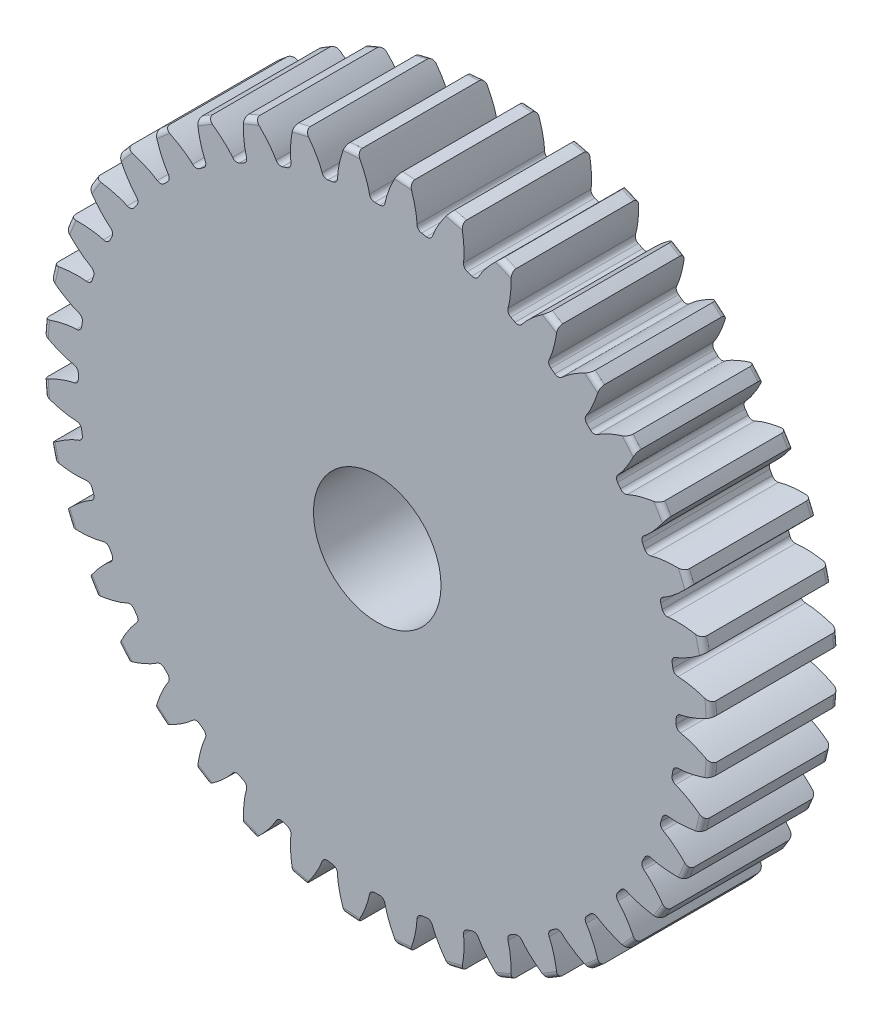
from build123d import *

# Parameters (mm, degrees)
BOSS_EXTRUDE1_DEPTH      = 7.1374
BOSS_EXTRUDE1_DEPTH_BACK = 7.1374
SKETCH3_R                = 16.66875
FILLET2_R                = 0.2663071221911928
CUT_EXTRUDE1_DEPTH       = 25.630000743934822
FILLET1_R                = 0.2663071221911928
CIRPATTERN1_COUNT        = 40
FILLET1_OF_CIRPATTERN1_R = 0.2663071221911928
CUT_EXTRUDE2_DEPTH       = 25.588822980641915
CUT_EXTRUDE2_DEPTH_BACK  = 25.588822980641915
SKETCH6_W                = 24.66629875686308
SKETCH6_H                = 10.369952092948171


with BuildPart() as part:
    # Sketch3 → Boss-Extrude1 (new, two sides: drawn at the far end of the back side and taken through both)
    with BuildSketch(Plane.XY.offset(-BOSS_EXTRUDE1_DEPTH_BACK)):
        Circle(SKETCH3_R)
    extrude(amount=BOSS_EXTRUDE1_DEPTH + BOSS_EXTRUDE1_DEPTH_BACK)

    # Sketch5 → Cut-Revolve1 (revolve, cut)
    with BuildSketch(Plane(origin=(0, 0, 0), x_dir=(0, 0, -1), z_dir=(1, 0, 0)), mode=Mode.PRIVATE) as cut_revolve1_sk:
        Polygon((-7.1373999999999995, 16.66875), (0.7873999999999978, 16.66875), (0.7873999999999987, 9.144), (-7.137399999999999, 9.144), align=None)
        Polygon((7.1373999999999995, 3.1750000000000007), (-7.1373999999999995, 3.174999999999999), (-7.1373999999999995, 0), (7.1373999999999995, 0), align=None)
    revolve(cut_revolve1_sk.sketch.rotate(Axis((0, 0, 7.1373999999999995), (0, 0, -1)), 90), axis=Axis((0, 0, 7.1373999999999995), (0, 0, -1)), mode=Mode.SUBTRACT)

    # Fillet2
    fillet2_edges = [part.edges().sort_by_distance(p)[0] for p in [
        (-3.174999999999999, -7.4e-16, 7.1373999999999995),
        (-3.1750000000000007, 6.7e-16, -7.1373999999999995),
        (-9.144, -2.14e-15, 7.137399999999999),
        (-9.144, -2.14e-15, -0.787399999999999),
        (-16.66875, -3.89e-15, -0.7873999999999981),
        (-16.66875, 2.04e-15, -7.1374),
    ]]
    fillet(fillet2_edges, radius=FILLET2_R)

    # Sketch4 → Cut-Extrude1 (cut, symmetric)
    with BuildSketch(Plane.XY):
        with BuildLine():
            Line((14.878394913615425, 0.3625916500126888), (14.913192436760546, 0.36343967773387753))
            add(Edge.make_bspline(
                [(14.913192436760546, 0.36343967773387753), (14.915932121481475, 0.36353536483762616), (14.923613753636184, 0.36389326556183066), (14.93812595328096, 0.364923436516246), (14.961789134486567, 0.3671065924709044), (14.991912200216108, 0.37062653396886414), (15.030810506890388, 0.3760239054275654), (15.076581712175361, 0.38347260287085266), (15.126823169889589, 0.3928010522901414), (15.181412660716978, 0.40418318886428944), (15.235805401505349, 0.41662899343107934), (15.289996240249774, 0.43005935981920074), (15.34391335816814, 0.4443535809238675), (15.409141174945624, 0.46275039060258905), (15.487236161426905, 0.48631369719140805), (15.578328649331821, 0.5160465696804971), (15.681407363841798, 0.5523534684857658), (15.786194231573836, 0.5921210257090447), (15.889077747834628, 0.6335237855495637), (15.992749607881887, 0.6779673165765551), (16.092859429641084, 0.7228189057523282), (16.196538779028582, 0.7720808866284067), (16.292085971657272, 0.8189122466179661), (16.398778373272442, 0.8743400482881091), (16.484777514083305, 0.919934702995408), (16.573306230946393, 0.9695016109098125), (16.61634781185909, 0.9939902846265547), (16.638325167068498, 1.006658927955753)],
                knots=[0, 0, 0, 0, 0, 0.00537674875354111, 0.01508368832264266, 0.02853182036800075, 0.04661013976043497, 0.06485484946688601, 0.0921105257527148, 0.1194761761445054, 0.14684249602329638, 0.17420885409832482, 0.20157495578181137, 0.228941013274206, 0.2563073451929492, 0.30703503230739143, 0.361767352019031, 0.416499661015152, 0.4712319369952871, 0.5259642822074043, 0.580696615768372, 0.6354289823953577, 0.690161387285753, 0.7448936880178444, 0.7996260820853568, 0.854358407268765, 0.9090909143223511, 0.9090909143223511, 0.9090909143223511, 0.9090909143223511, 0.9090909143223511], degree=4))
            ThreePointArc((16.638325167068498, 1.006658927955753), (16.66874999999514, 0), (16.638325167068498, -1.006658927955753))
            add(Edge.make_bspline(
                [(14.913192436760546, -0.36343967773387753), (14.915932121481475, -0.36353536483762633), (14.923613753636184, -0.3638932655618308), (14.93812595328096, -0.36492343651624615), (14.961789134486567, -0.36710659247090455), (14.991912200216108, -0.3706265339688643), (15.030810506890388, -0.3760239054275656), (15.076581712175361, -0.38347260287085283), (15.126823169889589, -0.3928010522901415), (15.181412660716978, -0.4041831888642896), (15.235805401505349, -0.4166289934310795), (15.289996240249774, -0.4300593598192009), (15.34391335816814, -0.4443535809238677), (15.409141174945624, -0.4627503906025892), (15.487236161426905, -0.4863136971914082), (15.578328649331821, -0.5160465696804973), (15.681407363841798, -0.552353468485766), (15.786194231573836, -0.5921210257090448), (15.889077747834628, -0.6335237855495639), (15.992749607881887, -0.6779673165765553), (16.092859429641084, -0.7228189057523284), (16.196538779028582, -0.7720808866284069), (16.292085971657272, -0.8189122466179664), (16.398778373272442, -0.8743400482881093), (16.484777514083305, -0.9199347029954085), (16.573306230946393, -0.9695016109098133), (16.616347811859093, -0.9939902846265556), (16.638325167068498, -1.006658927955753)],
                knots=[0, 0, 0, 0, 0, 0.00537674875354111, 0.01508368832264266, 0.02853182036800075, 0.04661013976043497, 0.06485484946688601, 0.0921105257527148, 0.1194761761445054, 0.14684249602329638, 0.17420885409832482, 0.20157495578181137, 0.228941013274206, 0.2563073451929492, 0.30703503230739143, 0.361767352019031, 0.416499661015152, 0.4712319369952871, 0.5259642822074043, 0.580696615768372, 0.6354289823953577, 0.690161387285753, 0.7448936880178444, 0.7996260820853568, 0.854358407268765, 0.9090909143223511, 0.9090909143223511, 0.9090909143223511, 0.9090909143223511, 0.9090909143223511], degree=4))
            Line((14.913192436760546, -0.36343967773387753), (14.878394913615425, -0.36259165001268856))
            ThreePointArc((14.878394913615425, -0.36259165001268856), (14.882812500000002, 1e-16), (14.878394913615425, 0.3625916500126888))
        make_face()
    cut_extrude1 = extrude(amount=CUT_EXTRUDE1_DEPTH, both=True, mode=Mode.SUBTRACT)

    # Fillet1
    fillet1_edges = [part.edges().sort_by_distance(p)[0] for p in [
        (14.878394913615427, -0.36259165001268856, -3.962399999999999),
        (14.878394913615427, 0.3625916500126888, -3.962399999999999),
    ]]
    fillet(fillet1_edges, radius=FILLET1_R)

    # CirPattern1: Cut-Extrude1 ×40 about axis
    cirpattern1_axis = Axis((0, 0, 7.1373999999999995), (0, 0, -1))
    for i in range(1, CIRPATTERN1_COUNT):
        add(cut_extrude1.rotate(cirpattern1_axis, i * 360 / CIRPATTERN1_COUNT), mode=Mode.SUBTRACT)

    # Fillet1 of CirPattern1
    fillet1_of_cirpattern1_edges = [part.edges().sort_by_distance(p)[0] for p in [
        (14.63849535215017, -2.6856212940834068, -3.962399999999999),
        (14.751939013745748, -1.9693662038540358, -3.962399999999999),
        (14.038147452734247, -4.942522028827724, -3.962399999999999),
        (14.262241416478993, -4.252831725830165, -3.962399999999999),
        (13.092133773091726, -7.077721467932129, -3.962399999999999),
        (13.421360101873022, -6.431578416377067, -3.962399999999999),
        (11.823748309654807, -9.03864391488521, -3.962399999999999),
        (12.25000035861851, -8.451958301127775, -3.962399999999999),
        (10.264222922063315, -10.777004951114497, -3.962399999999999),
        (10.777004951114499, -10.264222922063313, -3.962399999999999),
        (8.451958301127775, -12.25000035861851, -3.962399999999999),
        (9.03864391488521, -11.823748309654807, -3.962399999999999),
        (6.431578416377069, -13.42136010187302, -3.962399999999999),
        (7.077721467932131, -13.092133773091724, -3.962399999999999),
        (4.252831725830166, -14.262241416478993, -3.962399999999999),
        (4.9425220288277245, -14.038147452734245, -3.962399999999999),
        (1.969366203854037, -14.751939013745748, -3.962399999999999),
        (2.6856212940834077, -14.63849535215017, -3.962399999999999),
        (-0.36259165001268767, -14.878394913615427, -3.962399999999999),
        (0.36259165001268967, -14.878394913615427, -3.962399999999999),
        (-2.685621294083406, -14.63849535215017, -3.9623999999999975),
        (-1.969366203854035, -14.751939013745748, -3.9623999999999975),
        (-4.942522028827723, -14.038147452734249, -3.962399999999999),
        (-4.2528317258301644, -14.262241416478995, -3.962399999999999),
        (-7.077721467932128, -13.092133773091726, -3.962399999999999),
        (-6.431578416377066, -13.421360101873022, -3.962399999999999),
        (-9.038643914885208, -11.823748309654807, -3.9623999999999975),
        (-8.451958301127773, -12.25000035861851, -3.9623999999999975),
        (-10.777004951114497, -10.264222922063315, -3.962399999999999),
        (-10.264222922063313, -10.777004951114499, -3.962399999999999),
        (-12.250000358618509, -8.451958301127776, -3.962399999999999),
        (-11.823748309654805, -9.038643914885212, -3.962399999999999),
        (-13.42136010187302, -6.43157841637707, -3.962399999999999),
        (-13.092133773091724, -7.077721467932131, -3.962399999999999),
        (-14.262241416478993, -4.252831725830167, -3.962399999999999),
        (-14.038147452734245, -4.942522028827725, -3.962399999999999),
        (-14.751939013745746, -1.9693662038540378, -3.962399999999999),
        (-14.638495352150168, -2.6856212940834086, -3.962399999999999),
        (-14.878394913615427, 0.36259165001268673, -3.962399999999999),
        (-14.878394913615427, -0.3625916500126906, -3.962399999999999),
        (-14.63849535215017, 2.6856212940834046, -3.962399999999999),
        (-14.751939013745748, 1.9693662038540336, -3.962399999999999),
        (-14.038147452734249, 4.942522028827722, -3.962399999999999),
        (-14.262241416478995, 4.252831725830164, -3.962399999999999),
        (-13.092133773091726, 7.077721467932128, -3.9623999999999975),
        (-13.421360101873022, 6.431578416377066, -3.9623999999999975),
        (-11.823748309654809, 9.038643914885208, -3.9623999999999975),
        (-12.250000358618513, 8.451958301127773, -3.9623999999999975),
        (-10.264222922063317, 10.777004951114497, -3.962399999999999),
        (-10.7770049511145, 10.264222922063313, -3.962399999999999),
        (-8.451958301127776, 12.250000358618509, -3.962399999999999),
        (-9.038643914885212, 11.823748309654805, -3.962399999999999),
        (-6.43157841637707, 13.42136010187302, -3.962399999999999),
        (-7.077721467932131, 13.092133773091724, -3.962399999999999),
        (-4.252831725830168, 14.262241416478993, -3.9623999999999975),
        (-4.942522028827726, 14.038147452734245, -3.9623999999999975),
        (-1.9693662038540387, 14.751939013745746, -3.9623999999999975),
        (-2.6856212940834094, 14.638495352150168, -3.9623999999999975),
        (0.36259165001268584, 14.878394913615427, -3.962399999999999),
        (-0.3625916500126915, 14.878394913615427, -3.962399999999999),
        (2.6856212940834037, 14.63849535215017, -3.962399999999999),
        (1.9693662038540327, 14.751939013745748, -3.962399999999999),
        (4.942522028827721, 14.038147452734249, -3.962399999999999),
        (4.252831725830163, 14.262241416478995, -3.962399999999999),
        (7.077721467932127, 13.092133773091728, -3.962399999999999),
        (6.431578416377065, 13.421360101873024, -3.962399999999999),
        (9.038643914885206, 11.823748309654809, -3.962399999999999),
        (8.451958301127771, 12.250000358618513, -3.962399999999999),
        (10.777004951114495, 10.264222922063317, -3.962399999999999),
        (10.264222922063311, 10.7770049511145, -3.962399999999999),
        (12.250000358618509, 8.451958301127778, -3.962399999999999),
        (11.823748309654805, 9.038643914885213, -3.962399999999999),
        (13.42136010187302, 6.431578416377071, -3.962399999999999),
        (13.092133773091724, 7.0777214679321325, -3.962399999999999),
        (14.262241416478995, 4.252831725830169, -3.962399999999999),
        (14.038147452734245, 4.942522028827727, -3.962399999999999),
        (14.751939013745746, 1.9693662038540396, -3.962399999999999),
        (14.638495352150168, 2.6856212940834103, -3.962399999999999),
    ]]
    fillet(fillet1_of_cirpattern1_edges, radius=FILLET1_OF_CIRPATTERN1_R)

    # Sketch6 → Cut-Extrude2 (cut, two sides: drawn at the far end of the back side and taken through both)
    with BuildSketch(Plane(origin=(0, 0, 0), x_dir=(1, 0, 0), z_dir=(0, 1, 0)).offset(-CUT_EXTRUDE2_DEPTH_BACK)):
        with Locations((0.7605803838230516, -4.397576046474086)):
            Rectangle(SKETCH6_W, SKETCH6_H)
    extrude(amount=CUT_EXTRUDE2_DEPTH + CUT_EXTRUDE2_DEPTH_BACK, mode=Mode.SUBTRACT)


solid = part.part
